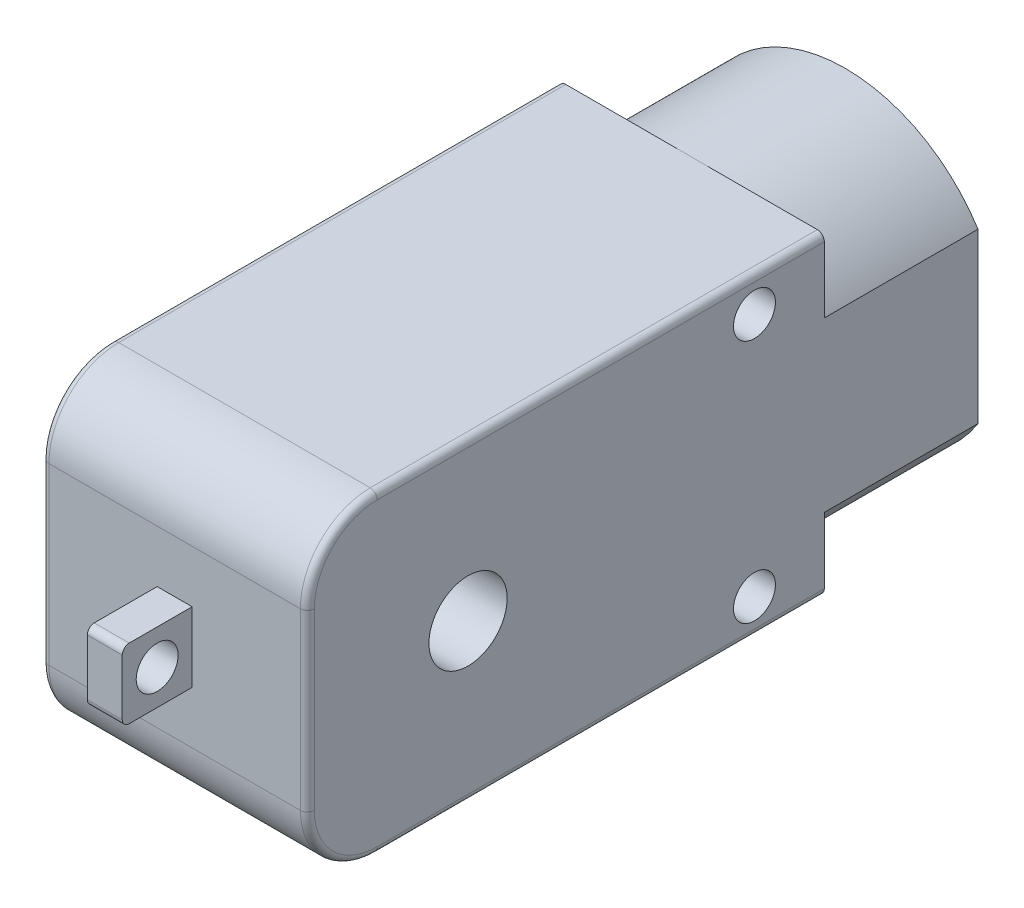
from build123d import *

# Parameters (mm, degrees)
SKETCH1_W           = 19
SKETCH1_H           = 22.5
BOSS_EXTRUDE1_DEPTH = 37
BOSS_EXTRUDE2_DEPTH = 11
FILLET1_R           = 5
SKETCH3_R           = 1.5
CUT_EXTRUDE1_DEPTH  = 44.087846314
SKETCH4_W           = 2.5
SKETCH4_H           = 5
BOSS_EXTRUDE3_DEPTH = 5
FILLET2_R           = 0.5
SKETCH5_R           = 1.5
CUT_EXTRUDE2_DEPTH  = 5
SKETCH6_R           = 2.8
CUT_EXTRUDE3_DEPTH  = 48.45063224
CUT_EXTRUDE4_DEPTH  = 11
SKETCH8_R           = 3
CUT_EXTRUDE5_DEPTH  = 2


with BuildPart() as part:
    # Sketch1 → Boss-Extrude1 (new body)
    with BuildSketch(Plane.XY):
        Rectangle(SKETCH1_W, SKETCH1_H)
    extrude(amount=BOSS_EXTRUDE1_DEPTH)

    # Sketch2 → Boss-Extrude2 (add)
    with BuildSketch(Plane(origin=(0, 0, 0), x_dir=(-1, 0, 0), z_dir=(0, 0, -1))):
        with BuildLine():
            Line((9.5, 6.025985397), (9.5, -6.025985397))
            ThreePointArc((9.5, -6.025985397), (0, -11.25), (-9.5, -6.025985397))
            Line((-9.5, -6.025985397), (-9.5, 6.025985397))
            ThreePointArc((-9.5, 6.025985397), (0, 11.25), (9.5, 6.025985397))
        make_face()
    extrude(amount=BOSS_EXTRUDE2_DEPTH)

    # Fillet1
    fillet1_edges = [part.edges().sort_by_distance(p)[0] for p in [
        (0, -11.25, 37),
        (0, 11.25, 37),
    ]]
    fillet(fillet1_edges, radius=FILLET1_R)

    # Sketch3 → Cut-Extrude1 (cut, through all)
    with BuildSketch(Plane(origin=(9.5, 0, 0), x_dir=(0, 0, -1), z_dir=(1, 0, 0))):
        with Locations((-5, 8.75)):
            Circle(SKETCH3_R)
        with Locations((-5, -8.75)):
            Circle(SKETCH3_R)
    extrude(amount=-CUT_EXTRUDE1_DEPTH, mode=Mode.SUBTRACT)

    # Sketch4 → Boss-Extrude3 (add)
    with BuildSketch(Plane.XY.offset(37)):
        Rectangle(SKETCH4_W, SKETCH4_H)
    extrude(amount=BOSS_EXTRUDE3_DEPTH)

    # Fillet2
    fillet2_edges = [part.edges().sort_by_distance(p)[0] for p in [
        (0, -2.5, 42),
        (0, 2.5, 42),
        (-9.5, -11.25, 16),
        (-9.5, -9.785533906, 35.535533906),
        (-9.5, 0, 37),
        (-9.5, 9.785533906, 35.535533906),
        (9.5, -11.25, 16),
        (9.5, -9.785533906, 35.535533906),
        (9.5, 0, 37),
        (9.5, 9.785533906, 35.535533906),
        (-9.5, 11.25, 16),
        (9.5, 11.25, 16),
    ]]
    fillet(fillet2_edges, radius=FILLET2_R)

    # Sketch5 → Cut-Extrude2 (cut)
    with BuildSketch(Plane(origin=(1.25, 0, 0), x_dir=(0, 0, -1), z_dir=(1, 0, 0))):
        with Locations((-39.5, 0)):
            Circle(SKETCH5_R)
    extrude(amount=-CUT_EXTRUDE2_DEPTH, mode=Mode.SUBTRACT)

    # Sketch6 → Cut-Extrude3 (cut, through all)
    with BuildSketch(Plane(origin=(9.5, 0, 0), x_dir=(0, 0, -1), z_dir=(1, 0, 0))):
        with Locations((-25.5, 0)):
            Circle(SKETCH6_R)
    extrude(amount=-CUT_EXTRUDE3_DEPTH, mode=Mode.SUBTRACT)

    # Sketch7 → Cut-Extrude4 (cut)
    with BuildSketch(Plane(origin=(0, 0, -11), x_dir=(-1, 0, 0), z_dir=(0, 0, -1))):
        with BuildLine():
            Line((-8.3, 5.666789214), (-8.3, -5.666789214))
            ThreePointArc((-8.3, -5.666789214), (0, -10.05), (8.3, -5.666789214))
            Line((8.3, -5.666789214), (8.3, 5.666789214))
            ThreePointArc((8.3, 5.666789214), (0, 10.05), (-8.3, 5.666789214))
        make_face()
    extrude(amount=-CUT_EXTRUDE4_DEPTH, mode=Mode.SUBTRACT)

    # Sketch8 → Cut-Extrude5 (cut)
    with BuildSketch(Plane(origin=(0, 0, 0), x_dir=(-1, 0, 0), z_dir=(0, 0, -1))):
        Circle(SKETCH8_R)
    extrude(amount=-CUT_EXTRUDE5_DEPTH, mode=Mode.SUBTRACT)


solid = part.part
